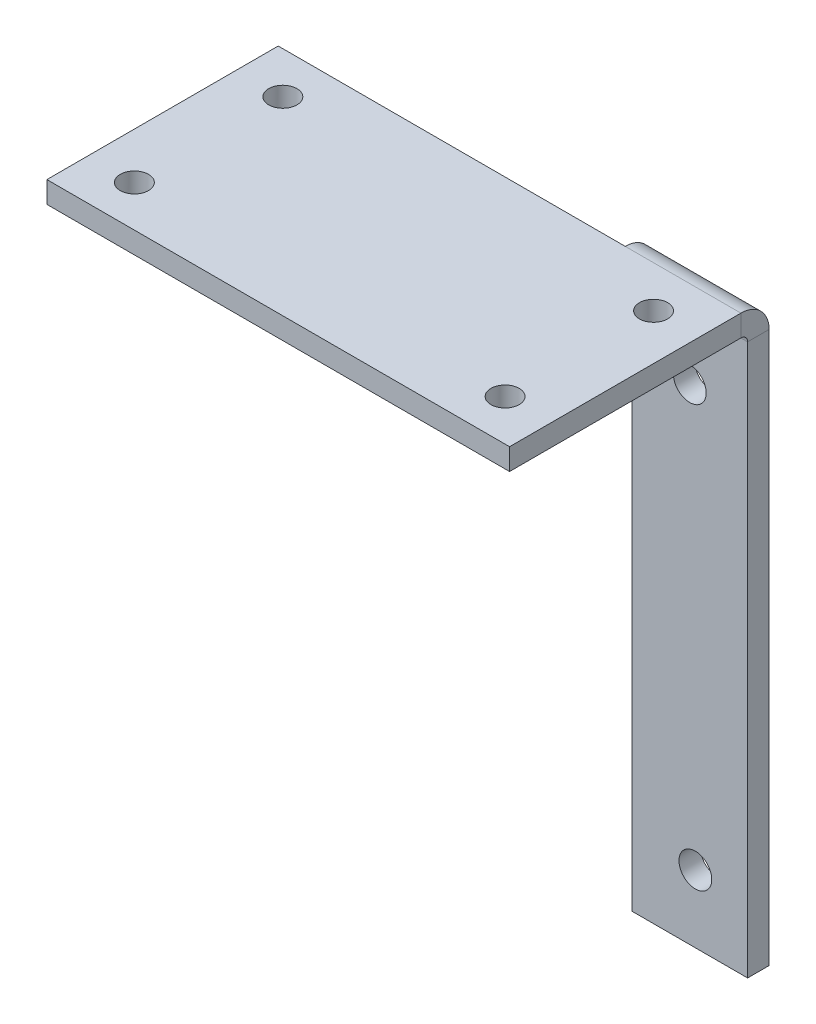
from build123d import *

# Parameters (mm, degrees)
SKETCH1_R                  = 1.79959
BASE_FLANGE1_DEPTH         = 2.3622
SKETCHED_START             = -88.9
SKETCHED_BEND1_OUTLINE_W   = 12.7
SKETCHED_BEND1_OUTLINE_H   = 2.3622
SKETCHED_BEND1_DEPTH       = 60.4012
SKETCHED_START_2           = -28.197410712
SKETCHED_BEND1_2_OUTLINE_W = 12.7
SKETCHED_BEND1_2_OUTLINE_H = 61.224283884
SKETCHED_BEND1_2_OUTLINE_R = 1.79959
SKETCHED_BEND1_2_DEPTH     = 2.060810712
SKETCHED_START_3           = -28.4988
SKETCHED_BEND1_3_OUTLINE_W = 12.7
SKETCHED_BEND1_3_OUTLINE_H = 61.224283884
SKETCHED_BEND1_3_OUTLINE_R = 1.79959
SKETCHED_BEND1_3_DEPTH     = 3.0988
SKETCHED_START_4           = 38.1
SKETCHED_BEND1_4_DEPTH     = 12.7
CUT_EXTRUDE1_REACH         = 88.233
SKETCH7_R                  = 1.55


with BuildPart() as part:
    # Base-Flange1: sheet metal written as solids
    # Sketch1 → Base-Flange1 (new body)
    with BuildSketch(Plane(origin=(0, 0, 0), x_dir=(1, 0, 0), z_dir=(0, 1, 0))):
        Polygon((50.8, 88.9), (50.8, 0), (0, 0), (0, 25.4), (38.1, 25.4), (38.1, 88.9), align=None)
        with Locations(Location((45.06468, 81.50352, 0), (0, 0, 270))):
            Circle(SKETCH1_R, mode=Mode.SUBTRACT)
        with Locations(Location((44.45, 35.56, 0), (0, 0, 270))):
            Circle(SKETCH1_R, mode=Mode.SUBTRACT)
    extrude(amount=-BASE_FLANGE1_DEPTH)

    # Sketched Bend1: read off the stored shape, not the designer's step
    # Sketched Bend1 outline → Sketched Bend1 (cut)
    with BuildSketch(Plane.XY.offset(SKETCHED_START)):
        with Locations((44.45, -1.1811)):
            Rectangle(SKETCHED_BEND1_OUTLINE_W, SKETCHED_BEND1_OUTLINE_H)
    extrude(amount=SKETCHED_BEND1_DEPTH, mode=Mode.SUBTRACT)

    # Sketched Bend1 2 outline → Sketched Bend1 2 (add)
    with BuildSketch(Plane.XY.offset(SKETCHED_START_2)):
        with Locations((44.45, -32.974341942)):
            Rectangle(SKETCHED_BEND1_2_OUTLINE_W, SKETCHED_BEND1_2_OUTLINE_H)
        with Locations((45.06468, -56.190003884)):
            Circle(SKETCHED_BEND1_2_OUTLINE_R, mode=Mode.SUBTRACT)
        with Locations((44.45, -10.246483884)):
            Circle(SKETCHED_BEND1_2_OUTLINE_R, mode=Mode.SUBTRACT)
    extrude(amount=SKETCHED_BEND1_2_DEPTH)

    # Sketched Bend1 3 outline → Sketched Bend1 3 (add)
    with BuildSketch(Plane.XY.offset(SKETCHED_START_3)):
        with Locations((44.45, -32.974341942)):
            Rectangle(SKETCHED_BEND1_3_OUTLINE_W, SKETCHED_BEND1_3_OUTLINE_H)
        with Locations((45.06468, -56.190003884)):
            Circle(SKETCHED_BEND1_3_OUTLINE_R, mode=Mode.SUBTRACT)
        with Locations((44.45, -10.246483884)):
            Circle(SKETCHED_BEND1_3_OUTLINE_R, mode=Mode.SUBTRACT)
    extrude(amount=SKETCHED_BEND1_3_DEPTH)

    # Sketched Bend1 4 outline → Sketched Bend1 4 (cut)
    with BuildSketch(Plane.YZ.offset(SKETCHED_START_4)):
        with BuildLine():
            ThreePointArc((0, -25.4), (-0.907617506, -27.591182494), (-3.0988, -28.4988))
            Line((-3.0988, -28.4988), (0, -28.4988))
            Line((0, -28.4988), (0, -25.4))
        make_face()
        with BuildLine():
            Line((-63.586483884, -26.1366), (-3.0988, -26.1366))
            ThreePointArc((-3.0988, -26.1366), (-2.577945145, -25.920854855), (-2.3622, -25.4))
            Line((-2.3622, -25.4), (-63.586483884, -25.4))
            Line((-63.586483884, -25.4), (-63.586483884, -26.1366))
        make_face()
    extrude(amount=SKETCHED_BEND1_4_DEPTH, mode=Mode.SUBTRACT)

    # Sketch7 → Cut-Extrude1 (cut, up to next)
    with BuildSketch(Plane(origin=(0, 0, 0), x_dir=(1, 0, 0), z_dir=(0, 1, 0)), mode=Mode.PRIVATE) as cut_extrude1_sk1:
        with Locations(Location((45.78, 20.828, 0), (0, 0, 270))):
            Circle(SKETCH7_R)
    cut_extrude1_tool1 = extrude(cut_extrude1_sk1.sketch, amount=-CUT_EXTRUDE1_REACH, mode=Mode.PRIVATE) & part.part
    # Sketch7 → Cut-Extrude1 (cut, up to next)
    with BuildSketch(Plane(origin=(0, 0, 0), x_dir=(1, 0, 0), z_dir=(0, 1, 0)), mode=Mode.PRIVATE) as cut_extrude1_sk2:
        with Locations(Location((5.08, 4.528, 0), (0, 0, 270))):
            Circle(SKETCH7_R)
    cut_extrude1_tool2 = extrude(cut_extrude1_sk2.sketch, amount=-CUT_EXTRUDE1_REACH, mode=Mode.PRIVATE) & part.part
    # Sketch7 → Cut-Extrude1 (cut, up to next)
    with BuildSketch(Plane(origin=(0, 0, 0), x_dir=(1, 0, 0), z_dir=(0, 1, 0)), mode=Mode.PRIVATE) as cut_extrude1_sk3:
        with Locations(Location((45.78, 4.528, 0), (0, 0, 270))):
            Circle(SKETCH7_R)
    cut_extrude1_tool3 = extrude(cut_extrude1_sk3.sketch, amount=-CUT_EXTRUDE1_REACH, mode=Mode.PRIVATE) & part.part
    # Sketch7 → Cut-Extrude1 (cut, up to next)
    with BuildSketch(Plane(origin=(0, 0, 0), x_dir=(1, 0, 0), z_dir=(0, 1, 0)), mode=Mode.PRIVATE) as cut_extrude1_sk4:
        with Locations(Location((5.08, 20.828, 0), (0, 0, 270))):
            Circle(SKETCH7_R)
    cut_extrude1_tool4 = extrude(cut_extrude1_sk4.sketch, amount=-CUT_EXTRUDE1_REACH, mode=Mode.PRIVATE) & part.part
    add(cut_extrude1_tool1.solids().sort_by_distance((45.78, 0, -20.828))[0], mode=Mode.SUBTRACT)
    add(cut_extrude1_tool2.solids().sort_by_distance((5.08, 0, -4.528))[0], mode=Mode.SUBTRACT)
    add(cut_extrude1_tool3.solids().sort_by_distance((45.78, 0, -4.528))[0], mode=Mode.SUBTRACT)
    add(cut_extrude1_tool4.solids().sort_by_distance((5.08, 0, -20.828))[0], mode=Mode.SUBTRACT)


solid = part.part
